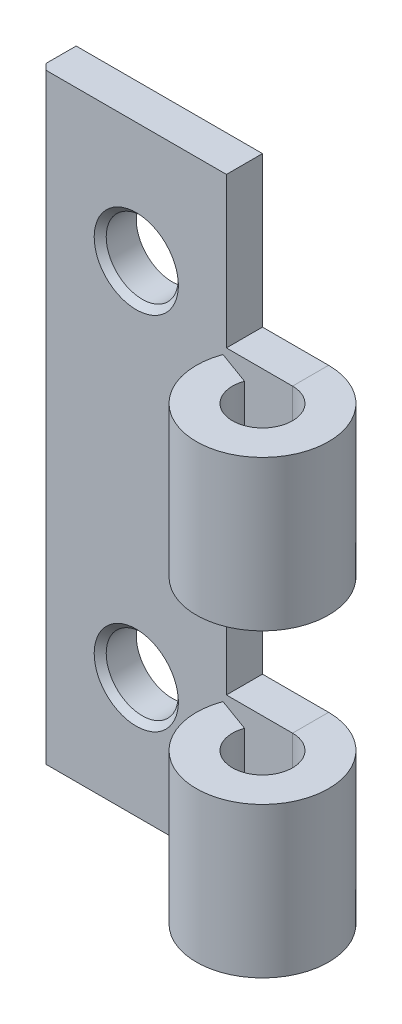
from build123d import *

# Parameters (mm, degrees)
SKETCH1_W                    = 21
SKETCH1_H                    = 50
BASE_FLANGE1_DEPTH           = 3
HEM1_START                   = -25
HEM1_DEPTH                   = 12.5
LPATTERN1_COUNT              = 2
LPATTERN1_PITCH              = 25
SKETCH9_W                    = 5.5
SKETCH9_H                    = 12.5
CUT_EXTRUDE5_DEPTH           = 3
F_6_0_6_DIAMETER_HOLE1_D     = 6
F_6_0_6_DIAMETER_HOLE1_DEPTH = 8
F_6_0_6_DIAMETER_HOLE1_TIP   = 1.802581857
CHAMFER1_SIZE                = 0.5


# Read off the part's stored shape, not the designer's step: Hem1
# Sheet-metal steps are written as plain solids
with BuildPart() as part:
    # Sketch1 → Base-Flange1 (new body)
    with BuildSketch(Plane.XY):
        Rectangle(SKETCH1_W, SKETCH1_H)
    extrude(amount=BASE_FLANGE1_DEPTH)

    # Hem1 outline → Hem1 (add)
    with BuildSketch(Plane(origin=(0, 0, 0), x_dir=(1, 0, 0), z_dir=(0, 1, 0)).offset(HEM1_START)):
        with BuildLine():
            Line((8.150768448, -4.644949642), (5.331690586, -3.618889212))
            ThreePointArc((5.331690586, -3.618889212), (13.654670401, -10.005336243), (10.5, 0))
            Line((10.5, 0), (10.5, -3))
            ThreePointArc((10.5, -3), (11.933941091, -7.547880111), (8.150768448, -4.644949642))
        make_face()
    hem1 = extrude(amount=HEM1_DEPTH)

    # LPattern1: Hem1 ×2
    with Locations(*[(0, i * LPATTERN1_PITCH, 0) for i in range(1, LPATTERN1_COUNT)]):
        add(hem1)

    # Sketch9 → Cut-Extrude5 (cut)
    with BuildSketch(Plane.XY.offset(3)):
        with Locations((7.75, 18.75)):
            Rectangle(SKETCH9_W, SKETCH9_H)
        with Locations((7.75, -6.25)):
            Rectangle(SKETCH9_W, SKETCH9_H)
    extrude(amount=-CUT_EXTRUDE5_DEPTH, mode=Mode.SUBTRACT)

    # Ø6.0 (6) Diameter Hole1
    with Locations(Plane(origin=(-2.5, 15, 3), x_dir=(1, 0, 0), z_dir=(0, 0, 1))):
        with Locations((0, 0), (0, -30)):
            Hole(F_6_0_6_DIAMETER_HOLE1_D / 2, depth=F_6_0_6_DIAMETER_HOLE1_DEPTH)
            with Locations((0, 0, -(F_6_0_6_DIAMETER_HOLE1_DEPTH + F_6_0_6_DIAMETER_HOLE1_TIP / 2))):  # 118° drill point
                Cone(0, F_6_0_6_DIAMETER_HOLE1_D / 2, F_6_0_6_DIAMETER_HOLE1_TIP, mode=Mode.SUBTRACT)

    # Chamfer1
    chamfer1_edges = [part.edges().sort_by_distance(p)[0] for p in [
        (-10.5, 0, 3),
        (0.5, -15, 3),
        (0.5, 15, 3),
    ]]
    chamfer(chamfer1_edges, length=CHAMFER1_SIZE)


solid = part.part
